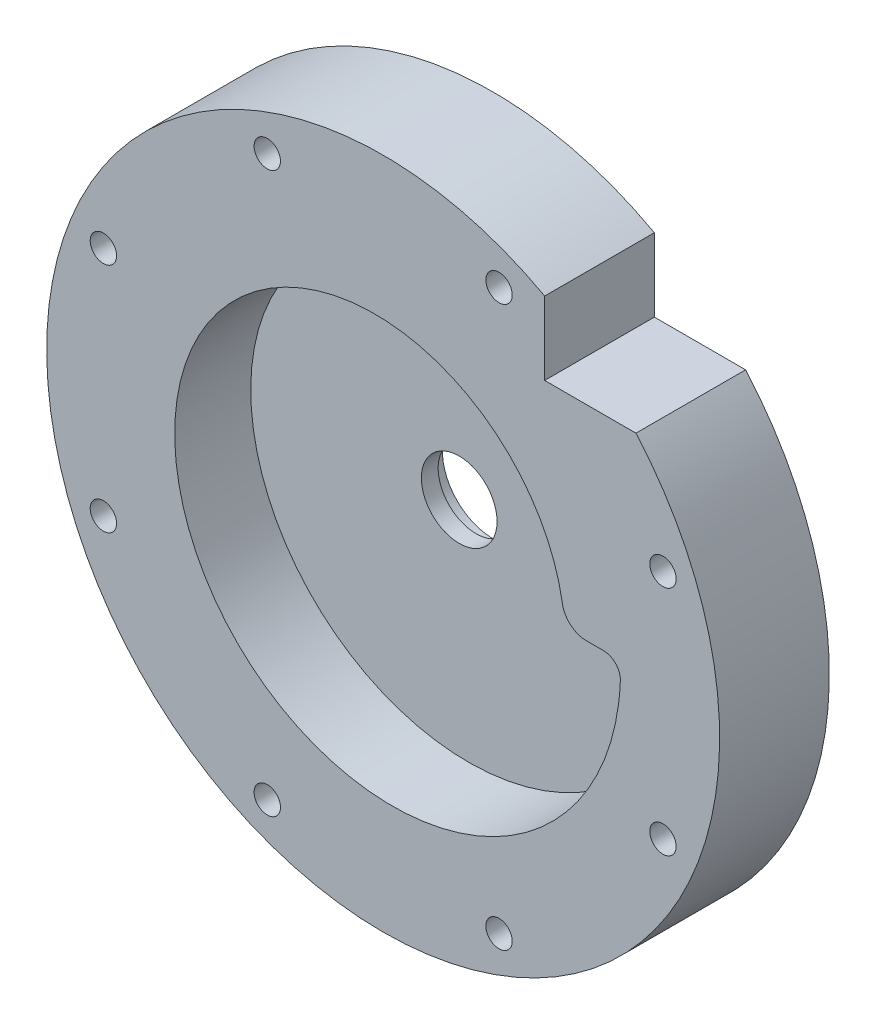
from build123d import *

# Parameters (mm, degrees)
VOLUTE_CUT_DEPTH      = 91.942021096
CAP_CUT_DEPTH         = 92.035204776
SKETCH28_W            = 17.225365526
SKETCH28_H            = 13.796548987
OUTLET_HOLE_CUT_DEPTH = 93.157644427
SKETCH26_R            = 2.4892
FASTENER_HOLE_DEPTH   = 93.157644427
FASTENER_HOLES_COUNT  = 8


with BuildPart() as part:
    # Sketch22 → Main Body (revolve)
    with BuildSketch(Plane(origin=(0, 0, 0), x_dir=(1, 0, 0), z_dir=(0, 1, 0))):
        Polygon((-25.4, 0), (-7.14375, 0), (-7.14375, 3.175), (-9.525, 3.175), (-9.525, 6.35), (-63.5, 6.35), (-63.5, -14.351), (-25.4, -14.351), align=None)
    revolve(axis=Axis((0, 0, 0), (0, 0, -1)))

    # Sketch23 → Volute Cut (cut, through all)
    with BuildSketch(Plane.XY):
        with BuildLine():
            Line((38.338438787, 3.304670655), (41.593494633, 3.304670655))
            ThreePointArc((41.593494633, 3.304670655), (43.883034366, 2.328238698), (44.763213962, 0))
            add(Edge.make_bspline(
                [(34.261847842, 0), (34.264784524, 0.071844985), (34.270658697, 0.215554733), (34.277793881, 0.431212342), (34.283685604, 0.646965689), (34.292740629, 1.07883436), (34.298205408, 2.088188166), (34.244713267, 3.603653756), (34.084824015, 5.4046479), (33.844223642, 7.127751114), (33.51671457, 8.840379872), (33.102704602, 10.538150267), (32.602833338, 12.216692386), (32.017965922, 13.871662747), (31.349191468, 15.498755899), (30.5978199, 17.093716034), (29.765379241, 18.652348338), (28.85361226, 20.170530201), (27.864472781, 21.644222235), (26.800121479, 23.069479109), (25.662921186, 24.442460162), (24.455431695, 25.759439779), (23.180404062, 27.016817518), (21.840774402, 28.21112794), (20.439657201, 29.339050137), (18.980338149, 30.397416931), (17.466266506, 31.383223709), (15.90104702, 32.293636882), (14.288431416, 33.126001944), (12.632309463, 33.877851098), (10.936699661, 34.546910451), (9.205739549, 35.131106723), (7.443675663, 35.628573491), (5.654853178, 36.037656917), (3.84370524, 36.356920959), (2.014742036, 36.585152051), (0.172539606, 36.721363228), (-1.678271559, 36.764797689), (-3.533018111, 36.714931787), (-5.3869956, 36.571477434), (-7.235480366, 36.334383913), (-9.07374153, 36.003839086), (-10.897053062, 35.58027), (-12.700705888, 35.064342878), (-14.480020006, 34.456962497), (-16.230356593, 33.759270957), (-17.947130045, 32.972645827), (-19.625819949, 32.098697681), (-21.261982935, 31.139267032), (-22.851264382, 30.096420656), (-24.389409957, 28.972447316), (-25.872276938, 27.769852906), (-27.29584531, 26.491355013), (-28.656228591, 25.139876909), (-29.949684369, 23.718540989), (-31.17262451, 22.230661674), (-32.32162502, 20.679737787), (-33.393435533, 19.069444419), (-34.384988385, 17.40362431), (-35.293407272, 15.686278765), (-36.11601545, 13.921558115), (-36.850343459, 12.113751764), (-37.494136352, 10.267277823), (-38.045360401, 8.38667238), (-38.502209273, 6.476578416), (-38.863109645, 4.541734393), (-39.126726243, 2.586962555), (-39.291966303, 0.617156959), (-39.357983419, -1.362728731), (-39.324180782, -3.347693652), (-39.190213789, -5.332702333), (-38.955992027, -7.312697422), (-38.621680597, -9.282612528), (-38.187700803, -11.23738514), (-37.654730183, -13.171969596), (-37.023701879, -15.081350059), (-36.295803353, -16.960553479), (-35.472474446, -18.804662496), (-34.555404779, -20.608828259), (-33.546530503, -22.368283123), (-32.448030404, -24.078353194), (-31.26232137, -25.734470685), (-29.992053224, -27.332186055), (-28.640102943, -28.867179894), (-27.209568266, -30.335274533), (-25.70376071, -31.732445327), (-24.12619801, -33.054831606), (-22.480595995, -34.298747245), (-20.770859922, -35.460690836), (-19.001075294, -36.537355425), (-17.175498164, -37.525637795), (-15.298544973, -38.422647266), (-13.374781932, -39.225713982), (-11.408913967, -39.93239668), (-9.405773269, -40.540489886), (-7.370307471, -41.048030557), (-5.307567475, -41.453304115), (-3.222694963, -41.754849874), (-1.120909625, -41.951465843), (0.992503863, -42.042212881), (3.11220909, -42.026418195), (5.232831344, -41.903678173), (7.348971199, -41.673860539), (9.455218223, -41.337105816), (11.546164776, -40.893828104), (13.616419848, -40.344715153), (15.660622923, -39.690727741), (17.673457812, -38.93309834), (19.649666438, -38.073329092), (21.584062524, -37.113189077), (23.471545152, -36.054710891), (25.307112165, -34.900186527), (27.085873367, -33.652162581), (28.803063488, -32.313434789), (30.454054887, -30.887041888), (32.034369952, -29.376258848), (33.539693165, -27.784589454), (34.9658828, -26.115758288), (36.30898223, -24.373702093), (37.565230795, -22.562560578), (38.731074224, -20.686666652), (39.803174556, -18.750536124), (40.778419563, -16.758856904), (41.653931621, -14.716477704), (42.427076016, -12.628396291), (43.09546867, -10.499747309), (43.656983249, -8.335789696), (44.109757635, -6.141893742), (44.437890089, -4.016226935), (44.606204477, -2.433517734), (44.678884826, -1.499236103), (44.704449619, -1.124895611), (44.721871029, -0.843919777), (44.737493089, -0.562768038), (44.751475519, -0.281457909), (44.759300821, -0.093827142), (44.763213962, 0)],
                knots=[0, 0, 0, 0, 0.0008712, 0.001742639, 0.002614317, 0.003486233, 0.006976282, 0.014842882, 0.021851749, 0.028876067, 0.0359159, 0.042971309, 0.050042349, 0.057129073, 0.064231529, 0.071349764, 0.078483823, 0.085633747, 0.092799578, 0.099981356, 0.107179117, 0.1143929, 0.121622741, 0.128868673, 0.136130732, 0.14340895, 0.15070336, 0.158013994, 0.165340883, 0.172684057, 0.180043546, 0.18741938, 0.194811587, 0.202220196, 0.209645235, 0.217086731, 0.224544712, 0.232019203, 0.239510231, 0.247017823, 0.254542004, 0.262082798, 0.269640231, 0.277214328, 0.284805113, 0.29241261, 0.300036843, 0.307677836, 0.31533561, 0.323010191, 0.3307016, 0.338409861, 0.346134995, 0.353877025, 0.361635972, 0.369411859, 0.377204707, 0.385014537, 0.392841372, 0.40068523, 0.408546135, 0.416424105, 0.424319163, 0.432231327, 0.440160619, 0.448107058, 0.456070665, 0.464051459, 0.47204946, 0.480064687, 0.48809716, 0.496146898, 0.50421392, 0.512298245, 0.520399892, 0.52851888, 0.536655227, 0.544808952, 0.552980073, 0.561168609, 0.569374578, 0.577597998, 0.585838887, 0.594097262, 0.602373142, 0.610666545, 0.618977488, 0.627305988, 0.635652063, 0.64401573, 0.652397007, 0.66079591, 0.669212457, 0.677646665, 0.686098551, 0.694568131, 0.703055422, 0.711560441, 0.720083205, 0.728623729, 0.737182031, 0.745758127, 0.754352033, 0.762963766, 0.771593341, 0.780240774, 0.788906083, 0.797589282, 0.806290387, 0.815009415, 0.823746381, 0.8325013, 0.841274189, 0.850065063, 0.858873938, 0.867700829, 0.876545751, 0.885408719, 0.89428975, 0.903188858, 0.912106059, 0.921041367, 0.929994798, 0.938966366, 0.947956087, 0.956963975, 0.965990046, 0.975034314, 0.984096794, 0.992041415, 0.994313871, 0.995450526, 0.996587467, 0.997724693, 0.998862204, 1, 1, 1, 1], degree=3))
            ThreePointArc((34.261847842, 0), (34.713967842, -0.470978061), (35.166087842, 0))
            ThreePointArc((35.166087842, 0), (36.047988032, 2.32841128), (38.338438787, 3.304670655))
        make_face()
    extrude(amount=VOLUTE_CUT_DEPTH, mode=Mode.SUBTRACT)

    # Sketch25 → Cap Cut (cut, through all)
    with BuildSketch(Plane.XY.offset(8.58012)):
        with BuildLine():
            Line((41.593494633, 3.304670655), (38.338438787, 3.304670655))
            ThreePointArc((38.338438787, 3.304670655), (35.382102361, 4.389545114), (33.829218893, 7.129149209))
            add(Edge.make_bspline(
                [(33.829218893, 7.129149209), (33.734655008, 7.700712878), (33.516311109, 8.842034383), (33.102704602, 10.538150267), (32.602833338, 12.216692386), (32.017965922, 13.871662747), (31.349191468, 15.498755899), (30.5978199, 17.093716034), (29.765379241, 18.652348338), (28.85361226, 20.170530201), (27.864472781, 21.644222235), (26.800121479, 23.069479109), (25.662921186, 24.442460162), (24.455431695, 25.759439779), (23.180404062, 27.016817518), (21.840774402, 28.21112794), (20.439657201, 29.339050137), (18.980338149, 30.397416931), (17.466266506, 31.383223709), (15.90104702, 32.293636882), (14.288431416, 33.126001944), (12.632309463, 33.877851098), (10.936699661, 34.546910451), (9.205739549, 35.131106723), (7.443675663, 35.628573491), (5.654853178, 36.037656917), (3.84370524, 36.356920959), (2.014742036, 36.585152051), (0.172539606, 36.721363228), (-1.678271559, 36.764797689), (-3.533018111, 36.714931787), (-5.3869956, 36.571477434), (-7.235480366, 36.334383913), (-9.07374153, 36.003839086), (-10.897053062, 35.58027), (-12.700705888, 35.064342878), (-14.480020006, 34.456962497), (-16.230356593, 33.759270957), (-17.947130045, 32.972645827), (-19.625819949, 32.098697681), (-21.261982935, 31.139267032), (-22.851264382, 30.096420656), (-24.389409957, 28.972447316), (-25.872276938, 27.769852906), (-27.29584531, 26.491355013), (-28.656228591, 25.139876909), (-29.949684369, 23.718540989), (-31.17262451, 22.230661674), (-32.32162502, 20.679737787), (-33.393435533, 19.069444419), (-34.384988385, 17.40362431), (-35.293407272, 15.686278765), (-36.11601545, 13.921558115), (-36.850343459, 12.113751764), (-37.494136352, 10.267277823), (-38.045360401, 8.38667238), (-38.502209273, 6.476578416), (-38.863109645, 4.541734393), (-39.126726243, 2.586962555), (-39.291966303, 0.617156959), (-39.357983419, -1.362728731), (-39.324180782, -3.347693652), (-39.190213789, -5.332702333), (-38.955992027, -7.312697422), (-38.621680597, -9.282612528), (-38.187700803, -11.23738514), (-37.654730183, -13.171969596), (-37.023701879, -15.081350059), (-36.295803353, -16.960553479), (-35.472474446, -18.804662496), (-34.555404779, -20.608828259), (-33.546530503, -22.368283123), (-32.448030404, -24.078353194), (-31.26232137, -25.734470685), (-29.992053224, -27.332186055), (-28.640102943, -28.867179894), (-27.209568266, -30.335274533), (-25.70376071, -31.732445327), (-24.12619801, -33.054831606), (-22.480595995, -34.298747245), (-20.770859922, -35.460690836), (-19.001075294, -36.537355425), (-17.175498164, -37.525637795), (-15.298544973, -38.422647266), (-13.374781932, -39.225713982), (-11.408913967, -39.93239668), (-9.405773269, -40.540489886), (-7.370307471, -41.048030557), (-5.307567475, -41.453304115), (-3.222694963, -41.754849874), (-1.120909625, -41.951465843), (0.992503863, -42.042212881), (3.11220909, -42.026418195), (5.232831344, -41.903678173), (7.348971199, -41.673860539), (9.455218223, -41.337105816), (11.546164776, -40.893828104), (13.616419848, -40.344715153), (15.660622923, -39.690727741), (17.673457812, -38.93309834), (19.649666438, -38.073329092), (21.584062524, -37.113189077), (23.471545152, -36.054710891), (25.307112165, -34.900186527), (27.085873367, -33.652162581), (28.803063488, -32.313434789), (30.454054887, -30.887041888), (32.034369952, -29.376258848), (33.539693165, -27.784589454), (34.9658828, -26.115758288), (36.30898223, -24.373702093), (37.565230795, -22.562560578), (38.731074224, -20.686666652), (39.803174556, -18.750536124), (40.778419563, -16.758856904), (41.653931621, -14.716477704), (42.427076016, -12.628396291), (43.09546867, -10.499747309), (43.656983249, -8.335789696), (44.109757635, -6.141893742), (44.437890089, -4.016226935), (44.606204477, -2.433517734), (44.678884826, -1.499236103), (44.704449619, -1.124895611), (44.721871029, -0.843919777), (44.737493089, -0.562768038), (44.751475519, -0.281457909), (44.759300821, -0.093827142), (44.763213962, 0)],
                knots=[0.028896694, 0.028896694, 0.028896694, 0.028896694, 0.0359159, 0.042971309, 0.050042349, 0.057129073, 0.064231529, 0.071349764, 0.078483823, 0.085633747, 0.092799578, 0.099981356, 0.107179117, 0.1143929, 0.121622741, 0.128868673, 0.136130732, 0.14340895, 0.15070336, 0.158013994, 0.165340883, 0.172684057, 0.180043546, 0.18741938, 0.194811587, 0.202220196, 0.209645235, 0.217086731, 0.224544712, 0.232019203, 0.239510231, 0.247017823, 0.254542004, 0.262082798, 0.269640231, 0.277214328, 0.284805113, 0.29241261, 0.300036843, 0.307677836, 0.31533561, 0.323010191, 0.3307016, 0.338409861, 0.346134995, 0.353877025, 0.361635972, 0.369411859, 0.377204707, 0.385014537, 0.392841372, 0.40068523, 0.408546135, 0.416424105, 0.424319163, 0.432231327, 0.440160619, 0.448107058, 0.456070665, 0.464051459, 0.47204946, 0.480064687, 0.48809716, 0.496146898, 0.50421392, 0.512298245, 0.520399892, 0.52851888, 0.536655227, 0.544808952, 0.552980073, 0.561168609, 0.569374578, 0.577597998, 0.585838887, 0.594097262, 0.602373142, 0.610666545, 0.618977488, 0.627305988, 0.635652063, 0.64401573, 0.652397007, 0.66079591, 0.669212457, 0.677646665, 0.686098551, 0.694568131, 0.703055422, 0.711560441, 0.720083205, 0.728623729, 0.737182031, 0.745758127, 0.754352033, 0.762963766, 0.771593341, 0.780240774, 0.788906083, 0.797589282, 0.806290387, 0.815009415, 0.823746381, 0.8325013, 0.841274189, 0.850065063, 0.858873938, 0.867700829, 0.876545751, 0.885408719, 0.89428975, 0.903188858, 0.912106059, 0.921041367, 0.929994798, 0.938966366, 0.947956087, 0.956963975, 0.965990046, 0.975034314, 0.984096794, 0.992041415, 0.994313871, 0.995450526, 0.996587467, 0.997724693, 0.998862204, 1, 1, 1, 1], degree=3))
            ThreePointArc((44.763213962, 0), (43.883034366, 2.328238698), (41.593494633, 3.304670655))
        make_face()
    extrude(amount=CAP_CUT_DEPTH, mode=Mode.SUBTRACT)

    # Sketch28 → Outlet Hole Cut (cut, through all)
    with BuildSketch(Plane.XY.offset(14.351)):
        with Locations((39.092682763, 48.808274494)):
            Rectangle(SKETCH28_W, SKETCH28_H)
    extrude(amount=-OUTLET_HOLE_CUT_DEPTH, mode=Mode.SUBTRACT)

    # Sketch26 → Fastener Hole (cut, through all)
    with BuildSketch(Plane.XY.offset(14.351)):
        with Locations((52.799715283, -21.87035816)):
            Circle(SKETCH26_R)
    fastener_hole = extrude(amount=-FASTENER_HOLE_DEPTH, mode=Mode.SUBTRACT)

    # Fastener Holes: Fastener Hole ×8 about axis
    fastener_holes_axis = Axis((0, 0, 0), (0, 0, 1))
    for i in range(1, FASTENER_HOLES_COUNT):
        add(fastener_hole.rotate(fastener_holes_axis, i * 360 / FASTENER_HOLES_COUNT), mode=Mode.SUBTRACT)


solid = part.part
